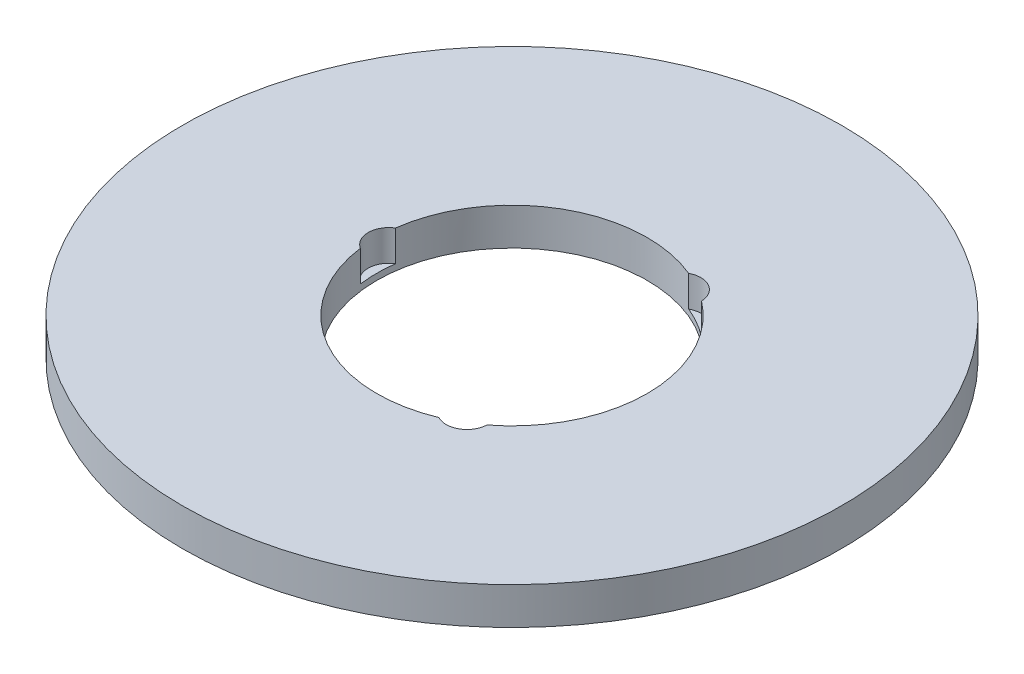
from build123d import *

# Parameters (mm, degrees)
SKETCH1_R           = 97.5
BOSS_EXTRUDE1_DEPTH = 11
SKETCH2_R           = 40
CUT_EXTRUDE1_DEPTH  = 139.32389526
SKETCH3_R           = 6.111419921
CUT_EXTRUDE2_DEPTH  = 9.146778329
CIRPATTERN1_COUNT   = 3


with BuildPart() as part:
    # Sketch1 → Boss-Extrude1 (new body)
    with BuildSketch(Plane(origin=(0, 0, 0), x_dir=(1, 0, 0), z_dir=(0, 1, 0))):
        Circle(SKETCH1_R)
    extrude(amount=BOSS_EXTRUDE1_DEPTH)

    # Sketch2 → Cut-Extrude1 (cut, through all)
    with BuildSketch(Plane(origin=(0, 0, 0), x_dir=(1, 0, 0), z_dir=(0, 1, 0))):
        Circle(SKETCH2_R)
    extrude(amount=CUT_EXTRUDE1_DEPTH, mode=Mode.SUBTRACT)

    # Sketch3 → Cut-Extrude2 (cut)
    with BuildSketch(Plane(origin=(0, 11, 0), x_dir=(1, 0, 0), z_dir=(0, 1, 0))):
        with Locations((-36.433455365, 0)):
            Circle(SKETCH3_R)
    cut_extrude2 = extrude(amount=-CUT_EXTRUDE2_DEPTH, mode=Mode.SUBTRACT)

    # CirPattern1: Cut-Extrude2 ×3 about axis
    cirpattern1_axis = Axis((0, 0, 0), (0, 1, 0))
    for i in range(1, CIRPATTERN1_COUNT):
        add(cut_extrude2.rotate(cirpattern1_axis, i * 360 / CIRPATTERN1_COUNT), mode=Mode.SUBTRACT)


solid = part.part
